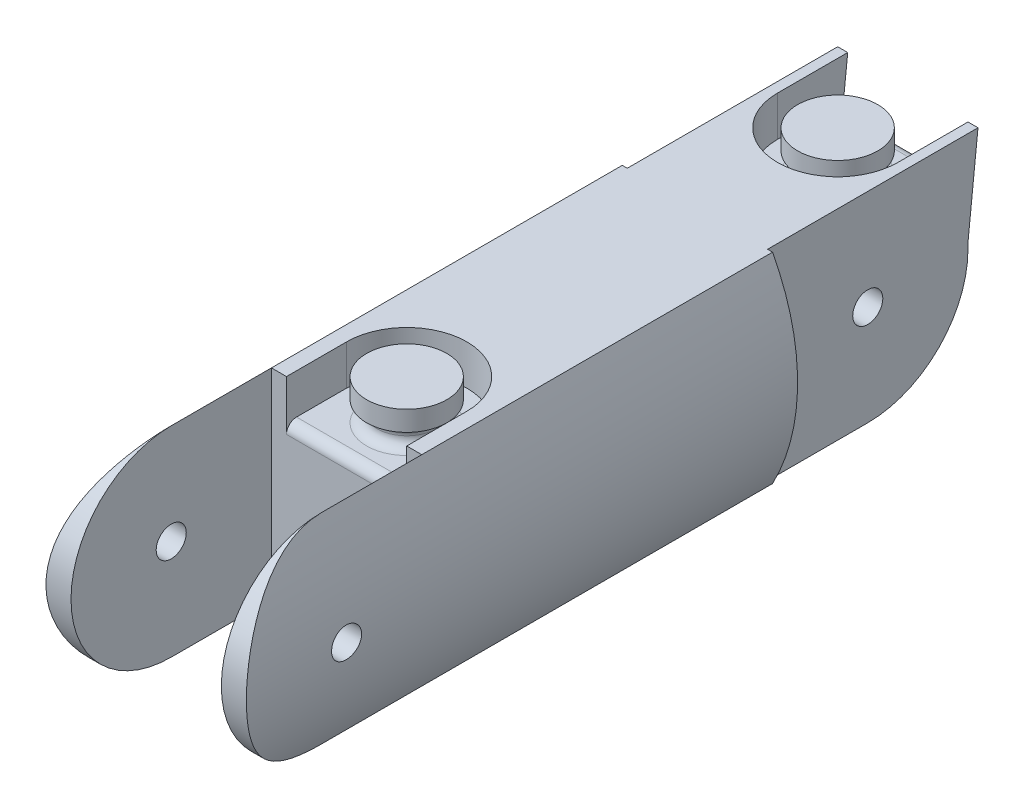
from build123d import *

# Parameters (mm, degrees)
SALIENTE_EXTRUIR2_DEPTH    = 55
CROQUIS4_R                 = 1.5
CORTAR_EXTRUIR1_DEPTH      = 50
SALIENTE_EXTRUIR3_DEPTH    = 20
CROQUIS8_R                 = 1.5
CORTAR_EXTRUIR4_DEPTH      = 14
REDONDEO1_R                = 10
CROQUIS6_W                 = 15
CROQUIS6_H                 = 20
CORTAR_EXTRUIR2_DEPTH      = 20
CORTAR_EXTRUIR3_DEPTH      = 57.789083458
CORTAR_EXTRUIR3_DEPTH_BACK = 57.789083458
CROQUIS7_R                 = 1.5
CUT_EXTRUDE1_DEPTH         = 4
SKETCH2_R                  = 3
BOSS_EXTRUDE1_DEPTH        = 2
SKETCH3_R                  = 4
BOSS_EXTRUDE2_DEPTH        = 2
FILLET1_R                  = 1
FILLET2_R                  = 1
FILLET3_R                  = 1
BOSS_EXTRUDE3_DEPTH        = 1
BOSS_EXTRUDE4_DEPTH        = 1


with BuildPart() as part:
    # Croquis2 → Saliente-Extruir2 (new body)
    with BuildSketch(Plane.XY):
        with BuildLine():
            Line((-7.5, -10), (7.5, -10))
            ThreePointArc((7.5, -10), (10, 0), (7.5, 10))
            Line((7.5, 10), (-7.5, 10))
            ThreePointArc((-7.5, 10), (-10, 0), (-7.5, -10))
        make_face()
    extrude(amount=SALIENTE_EXTRUIR2_DEPTH)

    # Croquis4 → Cortar-Extruir1 (cut)
    with BuildSketch(Plane(origin=(0, 0, 0), x_dir=(-1, 0, 0), z_dir=(0, 0, -1))):
        with Locations((0, -7)):
            Circle(CROQUIS4_R)
    extrude(amount=-CORTAR_EXTRUIR1_DEPTH, mode=Mode.SUBTRACT)

    # Croquis3 → Saliente-Extruir3 (add)
    with BuildSketch(Plane(origin=(0, 0, 0), x_dir=(-1, 0, 0), z_dir=(0, 0, -1))):
        Polygon((7, 10), (7, -10), (3, -10), (3, -3), (-3, -3), (-3, -10), (-7, -10), (-7, 10), align=None)
    extrude(amount=SALIENTE_EXTRUIR3_DEPTH)

    # Croquis8 → Cortar-Extruir4 (cut)
    with BuildSketch(Plane.ZY.offset(7)):
        with Locations((-10, 0)):
            Circle(CROQUIS8_R)
    extrude(amount=-CORTAR_EXTRUIR4_DEPTH, mode=Mode.SUBTRACT)

    # Redondeo1
    redondeo1_edges = [part.edges().sort_by_distance(p)[0] for p in [
        (5, -10, -20),
    ]]
    fillet(redondeo1_edges, radius=REDONDEO1_R)

    # Croquis6 → Cortar-Extruir2 (cut)
    with BuildSketch(Plane.XY.offset(55)):
        Rectangle(CROQUIS6_W, CROQUIS6_H)
    extrude(amount=-CORTAR_EXTRUIR2_DEPTH, mode=Mode.SUBTRACT)

    # Croquis7 → Cortar-Extruir3 (cut, two sides: drawn at the far end of the back side and taken through both)
    with BuildSketch(Plane(origin=(0, 0, 0), x_dir=(0, 0, -1), z_dir=(1, 0, 0)).offset(-CORTAR_EXTRUIR3_DEPTH_BACK)):
        with Locations((-45, 0)):
            Circle(CROQUIS7_R)
        with BuildLine():
            Line((-45, -10), (-60, -10))
            Line((-60, -10), (-60, 10))
            Line((-60, 10), (-45, 10))
            ThreePointArc((-45, 10), (-55, 0), (-45, -10))
        make_face()
    extrude(amount=CORTAR_EXTRUIR3_DEPTH + CORTAR_EXTRUIR3_DEPTH_BACK, mode=Mode.SUBTRACT)

    # Sketch1 → Cut-Extrude1 (cut)
    with BuildSketch(Plane(origin=(0, 10, 0), x_dir=(1, 0, 0), z_dir=(0, 1, 0))):
        with BuildLine():
            Line((-6, 14), (-6, 20))
            Line((-6, 20), (6, 20))
            Line((6, 20), (6, 14))
            ThreePointArc((6, 14), (0, 8), (-6, 14))
        make_face()
        with BuildLine():
            Line((-6, -29), (-6, -35))
            Line((-6, -35), (6, -35))
            Line((6, -35), (6, -29))
            ThreePointArc((6, -29), (0, -23), (-6, -29))
        make_face()
    extrude(amount=-CUT_EXTRUDE1_DEPTH, mode=Mode.SUBTRACT)

    # Sketch2 → Boss-Extrude1 (add)
    with BuildSketch(Plane(origin=(0, 6, 0), x_dir=(1, 0, 0), z_dir=(0, 1, 0))):
        with Locations(Location((0, -29, 0), (0, 0, 270))):
            Circle(SKETCH2_R)
        with Locations(Location((0, 14, 0), (0, 0, 270))):
            Circle(SKETCH2_R)
    extrude(amount=BOSS_EXTRUDE1_DEPTH)

    # Sketch3 → Boss-Extrude2 (add)
    with BuildSketch(Plane(origin=(0, 8, 0), x_dir=(1, 0, 0), z_dir=(0, 1, 0))):
        with Locations(Location((0, 14, 0), (0, 0, 270))):
            Circle(SKETCH3_R)
        with Locations(Location((0, -29, 0), (0, 0, 270))):
            Circle(SKETCH3_R)
    extrude(amount=BOSS_EXTRUDE2_DEPTH)

    # Fillet1
    fillet1_edges = [part.edges().sort_by_distance(p)[0] for p in [
        (0, 6, 26),
        (0, 8, 26),
        (0, 6, -17),
        (0, 8, -17),
    ]]
    fillet(fillet1_edges, radius=FILLET1_R - 0.0001)  # a hair under: the kernel refuses the full size

    # Fillet2
    fillet2_edges = [part.edges().sort_by_distance(p)[0] for p in [
        (0, 6, -20),
        (0, 6, 35),
    ]]
    fillet(fillet2_edges, radius=FILLET2_R)

    # Fillet3
    fillet3_edges = [part.edges().sort_by_distance(p)[0] for p in [
        (1.5, -7, 0),
        (1.5, -7, 35),
    ]]
    fillet(fillet3_edges, radius=FILLET3_R)

    # Sketch4 → Boss-Extrude3 (add)
    with BuildSketch(Plane(origin=(7, 0, 0), x_dir=(0, 0, -1), z_dir=(1, 0, 0))):
        Polygon((20, 10), (21, 10), (19.666009523, -2.562861663), align=None)
    extrude(amount=-BOSS_EXTRUDE3_DEPTH)

    # Sketch5 → Boss-Extrude4 (add)
    with BuildSketch(Plane.ZY.offset(7)):
        Polygon((-20, 10), (-21, 10), (-19.666009523, -2.562861663), align=None)
    extrude(amount=-BOSS_EXTRUDE4_DEPTH)


solid = part.part
